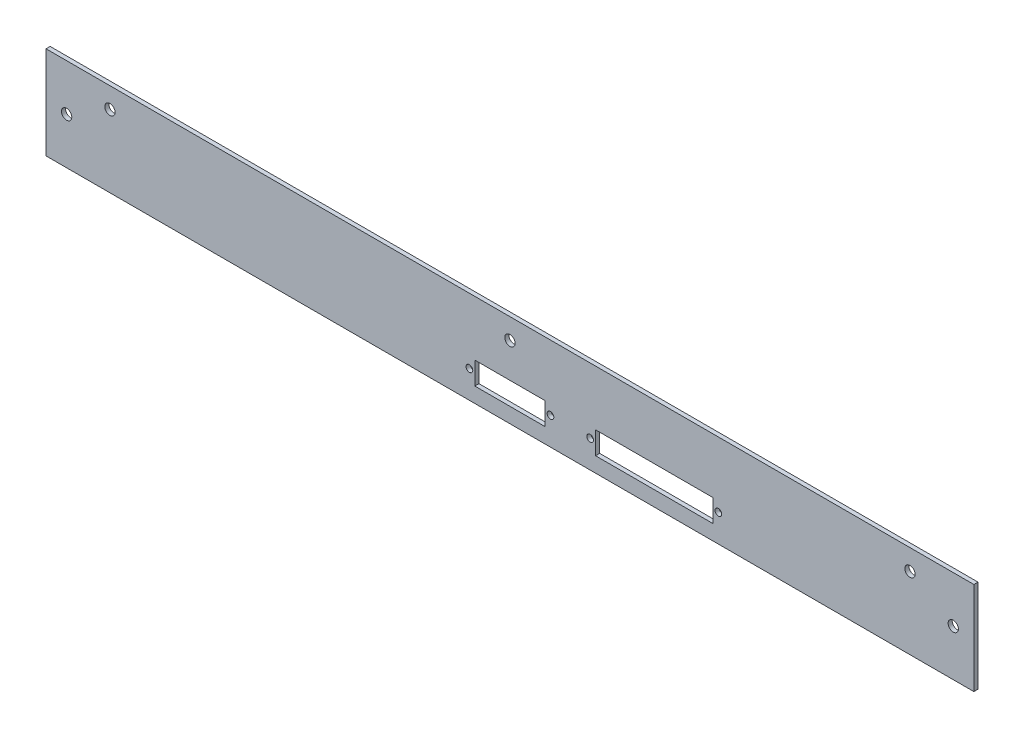
from build123d import *

# Parameters (mm, degrees)
SKETCH1_W                      = 450
SKETCH1_H                      = 45
BOSS_EXTRUDE1_DEPTH            = 2
TERMINAL_06P_CUTOUT_DEPTH      = 227.131046077
TERMINAL_06P_CUTOUT_DEPTH_BACK = 227.131046077
SK_TERMINAL_06P_CUTOUT_R       = 1.625
SK_TERMINAL_06P_CUTOUT_W       = 34.06
SK_TERMINAL_06P_CUTOUT_H       = 10.9
TERMINAL_12P_CUTOUT_DEPTH      = 227.131046077
TERMINAL_12P_CUTOUT_DEPTH_BACK = 227.131046077
SK_TERMINAL_12P_CUTOUT_R       = 1.625
SK_TERMINAL_12P_CUTOUT_W       = 56.92
SK_TERMINAL_12P_CUTOUT_H       = 10.9
SKETCH2_R                      = 2.5
CUT_EXTRUDE1_DEPTH             = 227.131046077


with BuildPart() as part:
    # Sketch1 → Boss-Extrude1 (new body)
    with BuildSketch(Plane.XY):
        Rectangle(SKETCH1_W, SKETCH1_H)
    extrude(amount=BOSS_EXTRUDE1_DEPTH)

    # SK Terminal 06P cutout → Terminal 06P cutout (cut, two sides: drawn at the far end of the back side and taken through both)
    with BuildSketch(Plane.XY.offset(-TERMINAL_06P_CUTOUT_DEPTH_BACK)):
        with Locations((-19.655, -9.125)):
            Circle(SK_TERMINAL_06P_CUTOUT_R)
        with Locations((19.655, -9.125)):
            Circle(SK_TERMINAL_06P_CUTOUT_R)
        with Locations((0, -9.725)):
            Rectangle(SK_TERMINAL_06P_CUTOUT_W, SK_TERMINAL_06P_CUTOUT_H)
    extrude(amount=TERMINAL_06P_CUTOUT_DEPTH + TERMINAL_06P_CUTOUT_DEPTH_BACK, mode=Mode.SUBTRACT)

    # SK Terminal 12P cutout → Terminal 12P cutout (cut, two sides: drawn at the far end of the back side and taken through both)
    with BuildSketch(Plane.XY.offset(-TERMINAL_12P_CUTOUT_DEPTH_BACK)):
        with Locations((38.915, -9.125)):
            Circle(SK_TERMINAL_12P_CUTOUT_R)
        with Locations((101.085, -9.125)):
            Circle(SK_TERMINAL_12P_CUTOUT_R)
        with Locations((70, -9.725)):
            Rectangle(SK_TERMINAL_12P_CUTOUT_W, SK_TERMINAL_12P_CUTOUT_H)
    extrude(amount=TERMINAL_12P_CUTOUT_DEPTH + TERMINAL_12P_CUTOUT_DEPTH_BACK, mode=Mode.SUBTRACT)

    # Sketch2 → Cut-Extrude1 (cut, through all)
    with BuildSketch(Plane.XY.offset(2)):
        with Locations((-215, 0)):
            Circle(SKETCH2_R)
        with Locations((215, 0)):
            Circle(SKETCH2_R)
        with Locations((-194, 12.495407459)):
            Circle(SKETCH2_R)
        with Locations((194, 12.495407459)):
            Circle(SKETCH2_R)
        with Locations((0, 12.5)):
            Circle(SKETCH2_R)
    extrude(amount=-CUT_EXTRUDE1_DEPTH, mode=Mode.SUBTRACT)


solid = part.part
